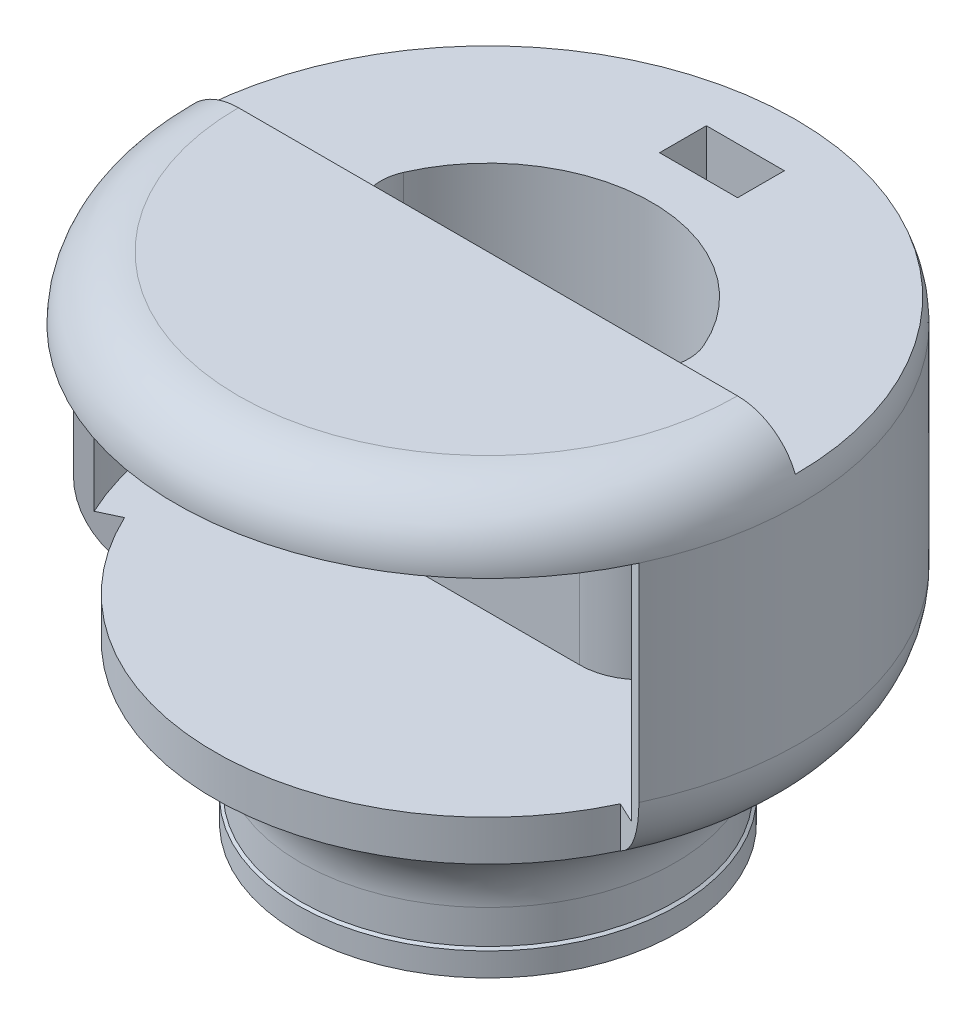
from build123d import *

# Parameters (mm, degrees)
CUT_EXTRUDE3_DEPTH           = 60
CUT_EXTRUDE5_DEPTH           = 2
CUT_EXTRUDE5_DEPTH_BACK      = 30
SKETCH9_R                    = 38
SKETCH9_R_2                  = 23
SKETCH19_W                   = 12
SKETCH19_H                   = 36.5
CUT_REVOLVE2_ANGLE           = 65
CUT_REVOLVE2_OTHER_WAY_ANGLE = 65
SKETCH21_W                   = 3.25
SKETCH21_H                   = 4
BOSS_EXTRUDE3_DEPTH          = 1.35
CIRPATTERN1_COUNT            = 5
CUT_EXTRUDE9_START           = -5
CUT_EXTRUDE9_DEPTH           = 5
SKETCH23_R                   = 10.5
CUT_EXTRUDE10_DEPTH          = 10
SKETCH24_W                   = 15
SKETCH24_H                   = 8
BOSS_EXTRUDE4_DEPTH          = 8
SKETCH26_W                   = 10
SKETCH26_H                   = 6
CUT_EXTRUDE11_DEPTH          = 10
SKETCH27_W                   = 4
SKETCH27_H                   = 5
CUT_EXTRUDE12_DEPTH          = 5
CUT_EXTRUDE14_DEPTH          = 2
CUT_EXTRUDE14_DEPTH_BACK     = 30
SKETCH29_R                   = 1
CUT_EXTRUDE15_DEPTH          = 15
FILLET1_R                    = 6
FILLET2_R                    = 8


with BuildPart() as part:
    # Sketch1 → Revolve1 (revolve)
    with BuildSketch(Plane.XY):
        with BuildLine():
            Line((0, 63.427876097), (32, 63.427876097))
            ThreePointArc((32, 63.427876097), (37.656854249, 61.084730346), (40, 55.427876097))
            Line((40, 55.427876097), (40, 28.846818009))
            ThreePointArc((40, 28.846818009), (38.792081772, 24.082439968), (35.460140376, 20.469057744))
            Line((35.460140376, 20.469057744), (28.539859624, 15.958818353))
            ThreePointArc((28.539859624, 15.958818353), (25.207918228, 12.345436129), (24, 7.581058088))
            Line((24, 7.581058088), (24, 3.25))
            Line((24, 3.25), (24.35, 3))
            Line((24.35, 3), (24.35, 0))
            Line((24.35, 0), (22.5, 0))
            Line((22.5, 0), (22.5, 12.5))
            ThreePointArc((22.5, 12.5), (22.353553391, 12.853553391), (22, 13))
            Line((22, 13), (0, 13))
            Line((0, 13), (0, 63.427876097))
        make_face()
    revolve(axis=Axis((0, 0, 0), (0, 1, 0)))

    # Sketch11 → Cut-Extrude3 (cut)
    with BuildSketch(Plane(origin=(0, 13, 0), x_dir=(-1, 0, 0), z_dir=(0, -1, 0))):
        with BuildLine():
            Line((-21, 0), (21, 0))
            ThreePointArc((21, 0), (0, 21), (-21, 0))
        make_face()
    extrude(amount=-CUT_EXTRUDE3_DEPTH, mode=Mode.SUBTRACT)

    # Sketch9 → Cut-Extrude5 (cut, two sides: drawn at the far end of the back side and taken through both)
    with BuildSketch(Plane(origin=(0, 55.427876097, 0), x_dir=(1, 0, 0), z_dir=(0, 1, 0)).offset(-CUT_EXTRUDE5_DEPTH_BACK)):
        Circle(SKETCH9_R)
        Circle(SKETCH9_R_2, mode=Mode.SUBTRACT)
    extrude(amount=CUT_EXTRUDE5_DEPTH + CUT_EXTRUDE5_DEPTH_BACK, mode=Mode.SUBTRACT)

    # Sketch19 → Cut-Revolve2 (revolve, cut)
    with BuildSketch(Plane(origin=(0, 0, 0), x_dir=(0, 0, -1), z_dir=(1, 0, 0))):
        with Locations((-41.064715832, 37.177876097)):
            Rectangle(SKETCH19_W, SKETCH19_H)
    revolve(axis=Axis((0, 0, 0), (0, 1, 0)), revolution_arc=CUT_REVOLVE2_ANGLE, mode=Mode.SUBTRACT)

    # Sketch19 → Cut-Revolve2 other way (revolve, cut)
    with BuildSketch(Plane(origin=(0, 0, 0), x_dir=(0, 0, -1), z_dir=(1, 0, 0))):
        with Locations((-41.064715832, 37.177876097)):
            Rectangle(SKETCH19_W, SKETCH19_H)
    revolve(axis=Axis((0, 0, 0), (0, -1, 0)), revolution_arc=CUT_REVOLVE2_OTHER_WAY_ANGLE, mode=Mode.SUBTRACT)

    # Sketch21 → Boss-Extrude3 (add)
    with BuildSketch(Plane(origin=(0, 0, 22.5), x_dir=(-1, 0, 0), z_dir=(0, 0, -1))):
        with Locations((0, 2)):
            Rectangle(SKETCH21_W, SKETCH21_H)
    boss_extrude3 = extrude(amount=BOSS_EXTRUDE3_DEPTH)

    # CirPattern1: Boss-Extrude3 ×5 about axis
    cirpattern1_axis = Axis((0, 0, 0), (0, -1, 0))
    for i in range(1, CIRPATTERN1_COUNT):
        add(boss_extrude3.rotate(cirpattern1_axis, i * 360 / CIRPATTERN1_COUNT))

    # Sketch22 → Cut-Extrude9 (cut)
    with BuildSketch(Plane(origin=(0, 63.427876097, 0), x_dir=(1, 0, 0), z_dir=(0, 1, 0)).offset(CUT_EXTRUDE9_START)):
        with BuildLine():
            Line((-40, 0), (40, 0))
            ThreePointArc((40, 0), (0, 40), (-40, 0))
        make_face()
    extrude(amount=CUT_EXTRUDE9_DEPTH, mode=Mode.SUBTRACT)

    # Sketch23 → Cut-Extrude10 (cut)
    with BuildSketch(Plane(origin=(0, 0, -40), x_dir=(-1, 0, 0), z_dir=(0, 0, -1))):
        with Locations((0, 42.137876097)):
            Circle(SKETCH23_R)
    extrude(amount=-CUT_EXTRUDE10_DEPTH, mode=Mode.SUBTRACT)

    # Sketch24 → Boss-Extrude4 (add)
    with BuildSketch(Plane(origin=(0, 58.427876097, 0), x_dir=(1, 0, 0), z_dir=(0, 1, 0))):
        with Locations((0, 30)):
            Rectangle(SKETCH24_W, SKETCH24_H)
    extrude(amount=-BOSS_EXTRUDE4_DEPTH)

    # Sketch26 → Cut-Extrude11 (cut)
    with BuildSketch(Plane(origin=(0, 58.427876097, 0), x_dir=(1, 0, 0), z_dir=(0, 1, 0))):
        with Locations((0, 30)):
            Rectangle(SKETCH26_W, SKETCH26_H)
    extrude(amount=-CUT_EXTRUDE11_DEPTH, mode=Mode.SUBTRACT)

    # Sketch27 → Cut-Extrude12 (cut)
    with BuildSketch(Plane(origin=(7.5, 0, 0), x_dir=(0, 0, -1), z_dir=(1, 0, 0))):
        with Locations((30, 53.927876097)):
            Rectangle(SKETCH27_W, SKETCH27_H)
    extrude(amount=-CUT_EXTRUDE12_DEPTH, mode=Mode.SUBTRACT)

    # Sketch28 → Cut-Extrude14 (cut, two sides: drawn at the far end of the back side and taken through both)
    with BuildSketch(Plane(origin=(0, 55.427876097, 0), x_dir=(1, 0, 0), z_dir=(0, 1, 0)).offset(-CUT_EXTRUDE14_DEPTH_BACK)):
        with BuildLine():
            Line((-22.912878475, -2), (22.912878475, -2))
            ThreePointArc((22.912878475, -2), (0, -23), (-22.912878475, -2))
        make_face()
    extrude(amount=CUT_EXTRUDE14_DEPTH + CUT_EXTRUDE14_DEPTH_BACK, mode=Mode.SUBTRACT)

    # Sketch29 → Cut-Extrude15 (cut)
    with BuildSketch(Plane(origin=(0, 0, 0), x_dir=(-1, 0, 0), z_dir=(0, 0, -1))):
        with Locations((-30.416198487, 60.927876097)):
            Circle(SKETCH29_R)
        with Locations((30.416198487, 60.927876097)):
            Circle(SKETCH29_R)
        with Locations((0, 60.927876097)):
            Circle(SKETCH29_R)
    extrude(amount=-CUT_EXTRUDE15_DEPTH, mode=Mode.SUBTRACT)

    # Fillet1
    fillet1_edges = [part.edges().sort_by_distance(p)[0] for p in [
        (-21, 35.713938048, 0),
        (21, 35.713938048, 0),
    ]]
    fillet(fillet1_edges, radius=FILLET1_R)

    # Fillet2
    fillet2_edges = [part.edges().sort_by_distance(p)[0] for p in [
        (22.912878475, 41.427876097, 2),
        (-22.912878475, 41.427876097, 2),
    ]]
    fillet(fillet2_edges, radius=FILLET2_R)


solid = part.part
